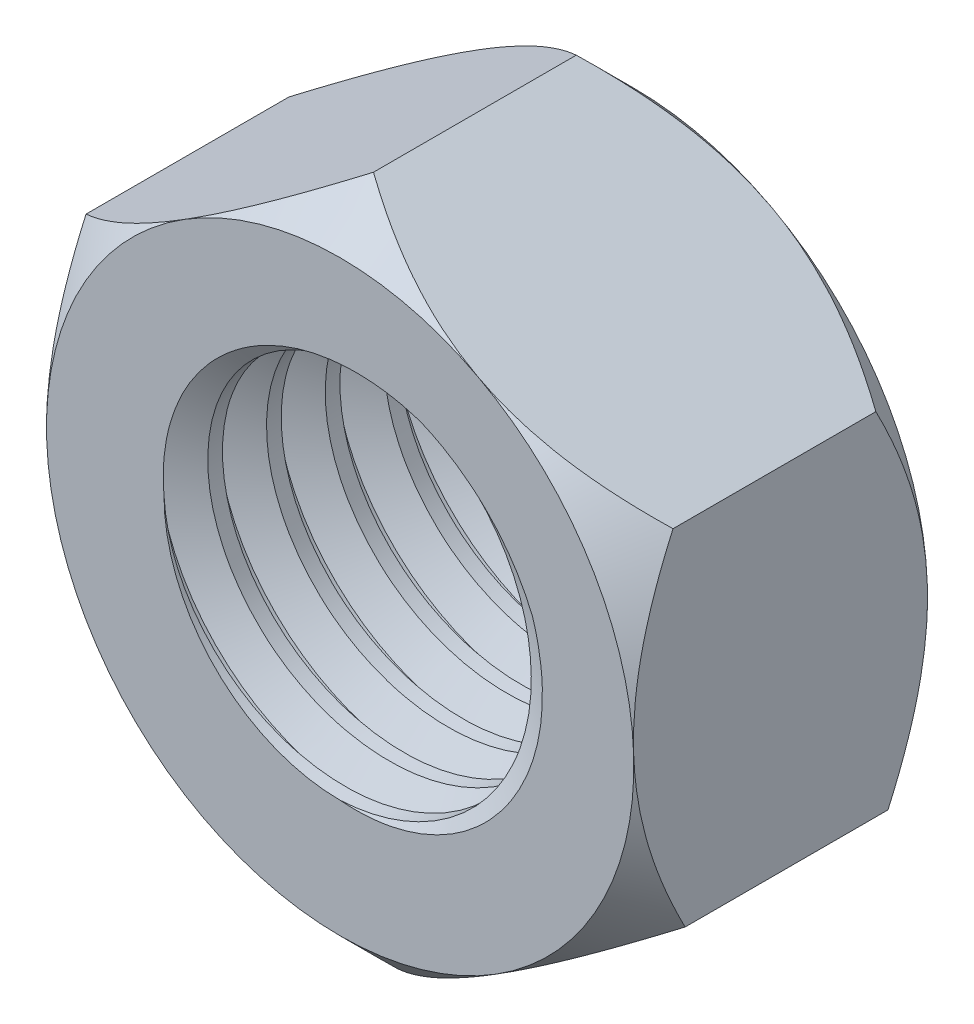
from build123d import *

# Parameters (mm, degrees)
SKETCH1_R               = 3
BOSS_EXTRUDE1_DEPTH     = 2.5
SKETCH4_OUTSIDE_W       = 47.438
SKETCH4_OUTSIDE_H       = 48.778
SKETCH4_OUTSIDE_R       = 5
CUT_EXTRUDE2_DEPTH      = 16
CUT_EXTRUDE2_DRAFT      = -45
MIRROR2_COPY_1_SKETCH_W = 47.438
MIRROR2_COPY_1_SKETCH_H = 48.778
MIRROR2_COPY_1_SKETCH_R = 5
MIRROR2_COPY_1_DEPTH    = 16
MIRROR2_COPY_1_DRAFT    = -45
SKETCH3_R               = 3
CUT_EXTRUDE4_DEPTH      = 26
THREAD3_PITCH           = 1


with BuildPart() as part:
    # Sketch1 → Boss-Extrude1 (new, symmetric)
    # profile 1 of 2: a face of its own
    with BuildSketch(Plane.XY):
        Polygon((-4.893588009, -3.063679117), (0.20642994, -5.76981109), (5.100017949, -2.706131973), (4.893588009, 3.063679117), (-0.20642994, 5.76981109), (-5.100017949, 2.706131973), align=None)
        Circle(SKETCH1_R, mode=Mode.SUBTRACT)
    # profile 2 of 2: a face of its own
    with BuildSketch(Plane.XY):
        Circle(SKETCH1_R)
    extrude(amount=BOSS_EXTRUDE1_DEPTH, both=True)


with BuildPart() as cut_extrude2_tool:
    # Sketch4 outside → Cut-Extrude2 (with draft: the straight prism first)
    with BuildSketch(Plane.XY.offset(2.5)):
        Rectangle(SKETCH4_OUTSIDE_W, SKETCH4_OUTSIDE_H)
        Circle(SKETCH4_OUTSIDE_R, mode=Mode.SUBTRACT)
    extrude(amount=-CUT_EXTRUDE2_DEPTH)
    # Cut-Extrude2: the draft: its side faces are tilted about the plane it starts from
    cut_extrude2_sides = [cut_extrude2_tool.faces().sort_by_distance(p)[0] for p in [
        (0, -24.389, -5.5),
        (23.719, 0, -5.5),
        (0, 24.389, -5.5),
        (-23.719, 0, -5.5),
        (-5, 0, -5.5),
    ]]
    draft(cut_extrude2_sides, Plane.XY.offset(2.5), CUT_EXTRUDE2_DRAFT)


with BuildPart() as part_1:
    add(part.part)

    # Cut-Extrude2: cut by cut_extrude2_tool
    add(cut_extrude2_tool.part, mode=Mode.SUBTRACT)


with BuildPart() as mirror2_copy_1_tool:
    # Mirror2 copy 1 sketch → Mirror2 copy 1 (with draft: the straight prism first)
    with BuildSketch(Plane(origin=(0, 0, -2.5), x_dir=(1, 0, 0), z_dir=(0, 0, -1))):
        Rectangle(MIRROR2_COPY_1_SKETCH_W, MIRROR2_COPY_1_SKETCH_H)
        Circle(MIRROR2_COPY_1_SKETCH_R, mode=Mode.SUBTRACT)
    extrude(amount=-MIRROR2_COPY_1_DEPTH)
    # Mirror2 copy 1: the draft: its side faces are tilted about the plane it starts from
    mirror2_copy_1_sides = [mirror2_copy_1_tool.faces().sort_by_distance(p)[0] for p in [
        (0, -24.389, 5.5),
        (23.719, 0, 5.5),
        (0, 24.389, 5.5),
        (-23.719, 0, 5.5),
        (-5, 0, 5.5),
    ]]
    draft(mirror2_copy_1_sides, Plane(origin=(0, 0, -2.5), x_dir=(1, 0, 0), z_dir=(0, 0, -1)), MIRROR2_COPY_1_DRAFT)


with BuildPart() as part_2:
    add(part_1.part)

    # Mirror2 copy 1: cut by mirror2_copy_1_tool
    add(mirror2_copy_1_tool.part, mode=Mode.SUBTRACT)

    # Sketch3 → Cut-Extrude4 (cut)
    with BuildSketch(Plane.XY.offset(2.5)):
        Circle(SKETCH3_R)
    extrude(amount=-CUT_EXTRUDE4_DEPTH, mode=Mode.SUBTRACT)

    # Thread3: the profile of Thread Profile4 profile screwed along a left-hand helix of 8 turns, 8 arcs to a turn; built about Z, then put on its axis
    thread3_z = Axis((0, 0, 0), (0, 0, 1))
    thread3_corners = [(2.9997, 0, -0.000173205), (3.541265875, 0, 0.312499999), (3.541265875, 0, 0.437499999), (2.9997, 0, 0.750173202)]
    with BuildLine(mode=Mode.PRIVATE) as thread3_profile:
        Line(thread3_corners[0], thread3_corners[1])
        Line(thread3_corners[1], thread3_corners[2])
        Line(thread3_corners[2], thread3_corners[3])
        Line(thread3_corners[3], thread3_corners[0])
    thread3_cap = Face(thread3_profile.wire())
    thread3_turn_angles = [0, -22.5, -45, -67.5, -90, -112.5, -135, -157.5, -180, -202.5, -225, -247.5, -270, -292.5, -315, -337.5, -360]
    thread3_turn_weights = [1, 0.9238795325112867, 1, 0.9238795325112867, 1, 0.9238795325112867, 1, 0.9238795325112867, 1, 0.9238795325112867, 1, 0.9238795325112867, 1, 0.9238795325112867, 1, 0.9238795325112867, 1]
    thread3_turn_rails = [Edge.make_bspline([Vector(p[0], p[1], 0).rotate(thread3_z, thread3_turn_angles[k]) / thread3_turn_weights[k] + Vector(0, 0, p[2] + -THREAD3_PITCH * thread3_turn_angles[k] / 360) for k in range(17)], [0, 0, 0, 1, 1, 2, 2, 3, 3, 4, 4, 5, 5, 6, 6, 7, 7, 8, 8, 8], 2, thread3_turn_weights) for p in thread3_corners]
    thread3_turn_sides = [Face.make_surface_from_curves(thread3_turn_rails[p[0]], thread3_turn_rails[p[1]]) for p in [(0, 1), (1, 2), (2, 3), (3, 0)]]
    thread3 = Plane(origin=(0, 0, 5.5), x_dir=(-1, 0, 0), z_dir=(0, 0, -1)) * Solid(Shell([*[p.moved(Location((0, 0, THREAD3_PITCH * i))) for i in range(8) for p in thread3_turn_sides], thread3_cap, thread3_cap.rotate(thread3_z, -2880).moved(Location((0, 0, -THREAD3_PITCH * -2880 / 360)))]))
    add(thread3, mode=Mode.SUBTRACT)


solid = part_2.part
